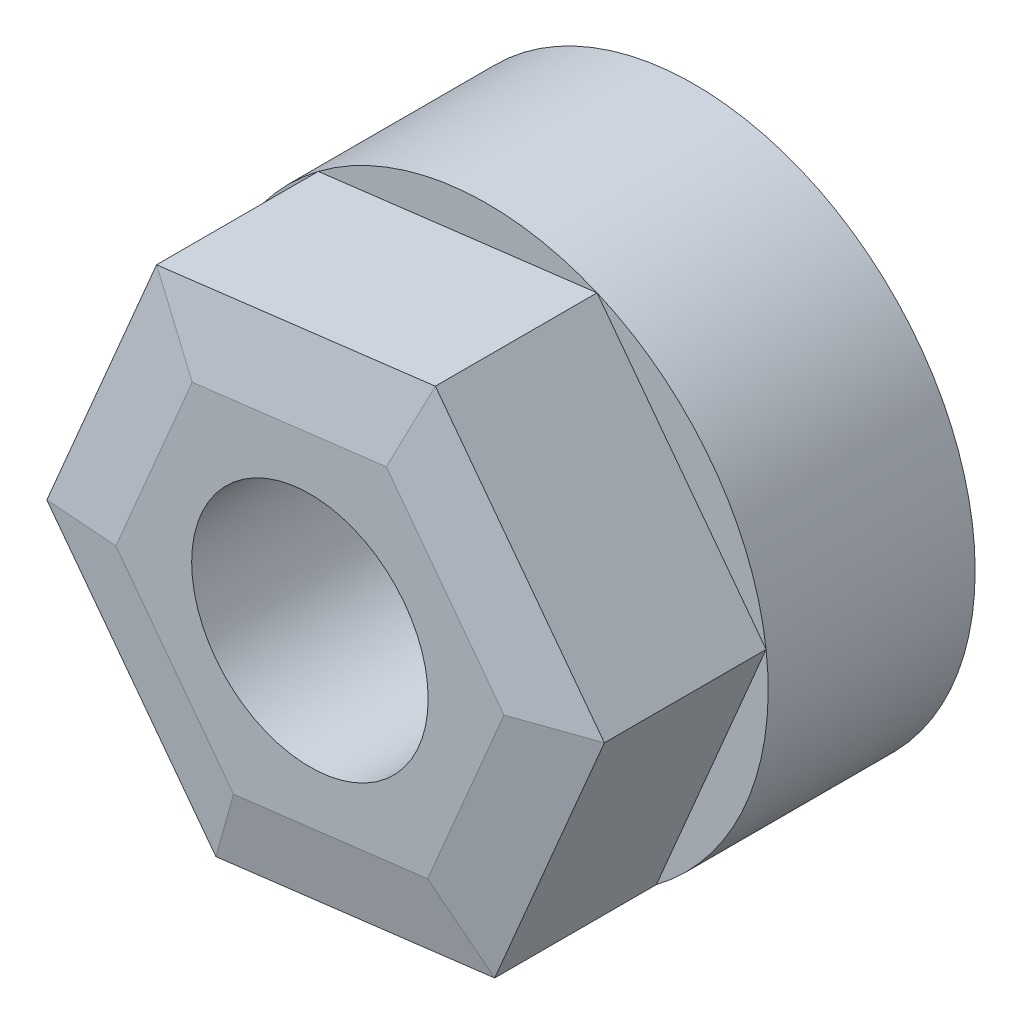
from build123d import *

# Parameters (mm, degrees)
CROQUIS1_R              = 9.5
SALIENTE_EXTRUIR1_DEPTH = 7
SALIENTE_EXTRUIR2_DEPTH = 6
CROQUIS3_R              = 4
CORTAR_EXTRUIR1_DEPTH   = 19.694919096
CHAFL_N1_SIZE           = 2.5
CHAFL_N1_SIZE2          = 0.531391404


with BuildPart() as part:
    # Croquis1 → Saliente-Extruir1 (new body)
    with BuildSketch(Plane.XY):
        Circle(CROQUIS1_R)
    extrude(amount=SALIENTE_EXTRUIR1_DEPTH)

    # Croquis2 → Saliente-Extruir2 (add)
    with BuildSketch(Plane.XY.offset(7)):
        Polygon((3.711506212, 8.744982655), (-5.717624029, 7.586749994), (-9.429130241, -1.158232661), (-3.711506212, -8.744982655), (5.717624029, -7.586749994), (9.429130241, 1.158232661), align=None)
    extrude(amount=SALIENTE_EXTRUIR2_DEPTH)

    # Croquis3 → Cortar-Extruir1 (cut, through all)
    with BuildSketch(Plane.XY.offset(13)):
        Circle(CROQUIS3_R)
    extrude(amount=-CORTAR_EXTRUIR1_DEPTH, mode=Mode.SUBTRACT)

    # Chaflán1
    chafl_n1_edges = [part.edges().sort_by_distance(p)[0] for p in [
        (-7.573377135, 3.214258666, 13),
        (-1.003058908, 8.165866324, 13),
        (6.570318227, 4.951607658, 13),
        (7.573377135, -3.214258666, 13),
        (1.003058908, -8.165866324, 13),
        (-6.570318227, -4.951607658, 13),
    ]]
    chafl_n1_side = [part.faces().sort_by_distance(p)[0] for p in [
        (-0.97170094, 7.910582237, 13),
    ]]
    chamfer(chafl_n1_edges, length=CHAFL_N1_SIZE, length2=CHAFL_N1_SIZE2, reference=chafl_n1_side[0])


solid = part.part
